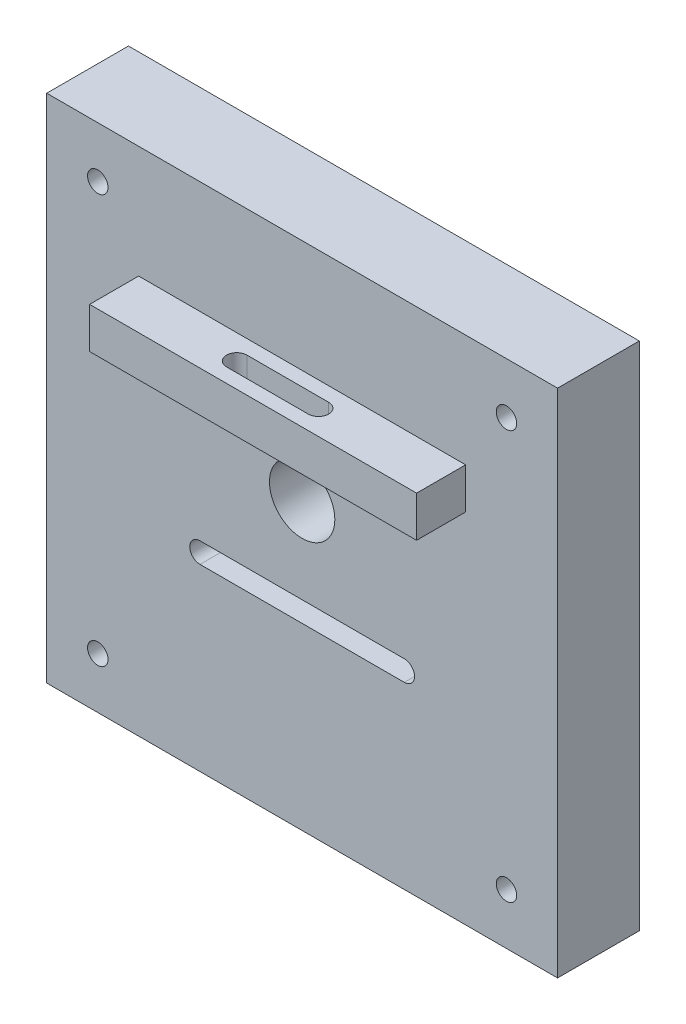
from build123d import *

# Parameters (mm, degrees)
SKETCH1_W           = 125
SKETCH1_H           = 125
BOSS_EXTRUDE1_DEPTH = 20
SKETCH2_R           = 2.5
CUT_EXTRUDE1_DEPTH  = 95.375743383
SKETCH3_R           = 8
CUT_EXTRUDE2_DEPTH  = 95.375743383
SKETCH4_W           = 70
SKETCH4_H           = 15
CUT_EXTRUDE3_DEPTH  = 10
FILLET1_R           = 5
SKETCH6_W           = 80
SKETCH6_H           = 10
BOSS_EXTRUDE2_DEPTH = 12
CUT_EXTRUDE4_DEPTH  = 123.375593875


with BuildPart() as part:
    # Sketch1 → Boss-Extrude1 (new body)
    with BuildSketch(Plane.XY):
        with Locations((4.174852652, 1.227897839)):
            Rectangle(SKETCH1_W, SKETCH1_H)
    extrude(amount=BOSS_EXTRUDE1_DEPTH)

    # Sketch2 → Cut-Extrude1 (cut, through all)
    with BuildSketch(Plane.XY.offset(20)):
        with Locations((-45.825147348, 51.227897839)):
            Circle(SKETCH2_R)
        with Locations((54.174852652, 51.227897839)):
            Circle(SKETCH2_R)
        with Locations((54.174852652, -48.772102161)):
            Circle(SKETCH2_R)
        with Locations((-45.825147348, -48.772102161)):
            Circle(SKETCH2_R)
    extrude(amount=-CUT_EXTRUDE1_DEPTH, mode=Mode.SUBTRACT)

    # Sketch3 → Cut-Extrude2 (cut, through all)
    with BuildSketch(Plane.XY.offset(20)):
        with Locations((4.174852652, 8.627897839)):
            Circle(SKETCH3_R)
        with BuildLine():
            Line((-20.825147348, -12.372102161), (29.174852652, -12.372102161))
            ThreePointArc((29.174852652, -12.372102161), (31.674852652, -14.872102161), (29.174852652, -17.372102161))
            Line((29.174852652, -17.372102161), (-20.825147348, -17.372102161))
            ThreePointArc((-20.825147348, -17.372102161), (-23.325147348, -14.872102161), (-20.825147348, -12.372102161))
        make_face()
    extrude(amount=-CUT_EXTRUDE2_DEPTH, mode=Mode.SUBTRACT)

    # Sketch4 → Cut-Extrude3 (cut)
    with BuildSketch(Plane(origin=(0, 0, 0), x_dir=(-1, 0, 0), z_dir=(0, 0, -1))):
        with Locations((-4.174852652, -14.872102161)):
            Rectangle(SKETCH4_W, SKETCH4_H)
    extrude(amount=-CUT_EXTRUDE3_DEPTH, mode=Mode.SUBTRACT)

    # Fillet1
    fillet1_edges = [part.edges().sort_by_distance(p)[0] for p in [
        (-30.825147348, -22.372102161, 5),
        (39.174852652, -22.372102161, 5),
        (-30.825147348, -7.372102161, 5),
        (39.174852652, -7.372102161, 5),
    ]]
    fillet(fillet1_edges, radius=FILLET1_R)

    # Sketch6 → Boss-Extrude2 (add)
    with BuildSketch(Plane.XY.offset(20)):
        with Locations((4.174852652, 31.227897839)):
            Rectangle(SKETCH6_W, SKETCH6_H)
    extrude(amount=BOSS_EXTRUDE2_DEPTH)

    # Sketch7 → Cut-Extrude4 (cut, through all)
    with BuildSketch(Plane(origin=(0, 36.227897839, 0), x_dir=(1, 0, 0), z_dir=(0, 1, 0))):
        with BuildLine():
            Line((-5.825147348, -28.5), (14.174852652, -28.5))
            ThreePointArc((14.174852652, -28.5), (16.674852652, -26), (14.174852652, -23.5))
            Line((14.174852652, -23.5), (-5.825147348, -23.5))
            ThreePointArc((-5.825147348, -23.5), (-8.325147348, -26), (-5.825147348, -28.5))
        make_face()
    extrude(amount=-CUT_EXTRUDE4_DEPTH, mode=Mode.SUBTRACT)


solid = part.part
